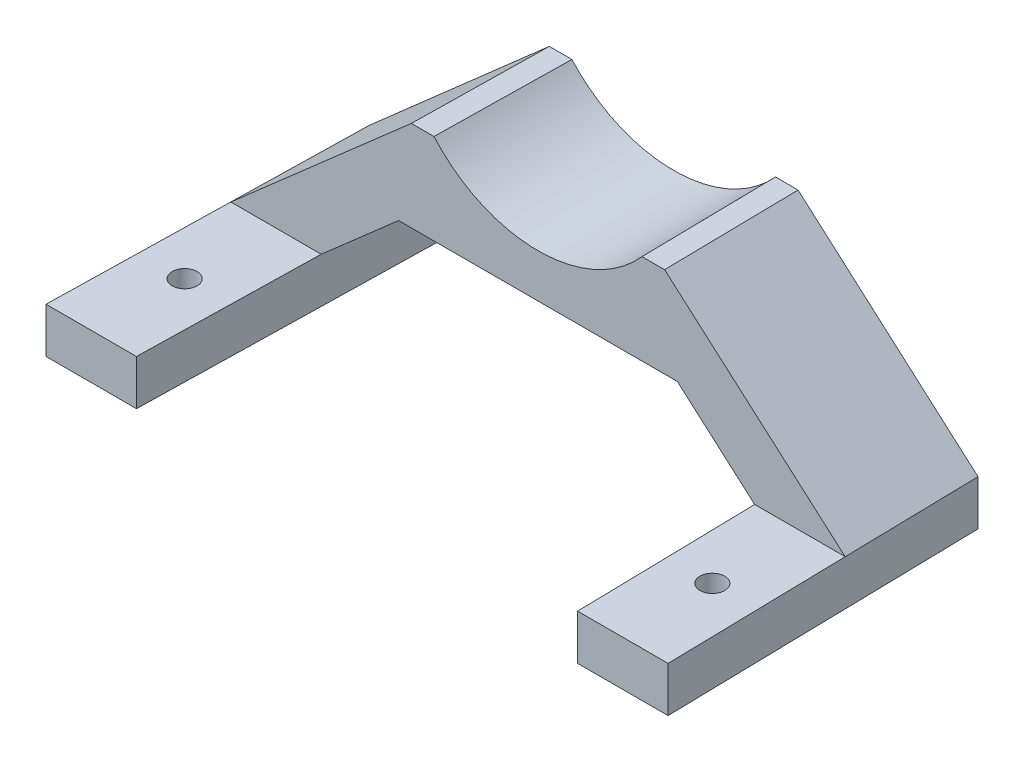
from build123d import *

# Parameters (mm, degrees)
SKETCH1_R             = 2.75
BOSS_EXTRUDE1_DEPTH   = 10
BOSS_EXTRUDE1_2_DEPTH = 10


with BuildPart() as part:
    # Sketch1 → Boss-Extrude1 (new body)
    with BuildSketch(Plane(origin=(0, 0, 0), x_dir=(1, 0, 0), z_dir=(0, 1, 0))):
        Polygon((0, 0), (20.004497681, 0), (21.489122754, 70), (1.484625073, 70), align=None)
        with Locations((10.430924608, 20.212041611)):
            Circle(SKETCH1_R, mode=Mode.SUBTRACT)
    extrude(amount=BOSS_EXTRUDE1_DEPTH)



with BuildPart() as body_2:
    # Sketch1 → Boss-Extrude1 2 (new body)
    with BuildSketch(Plane(origin=(0, 0, 0), x_dir=(1, 0, 0), z_dir=(0, 1, 0))):
        Polygon((116.0383729, 70), (136.042870581, 70), (137.527495654, 0), (117.522997972, 0), align=None)
        with Locations((127.096571045, 20.212041611)):
            Circle(SKETCH1_R, mode=Mode.SUBTRACT)
    extrude(amount=BOSS_EXTRUDE1_2_DEPTH)


with BuildPart() as part_1:
    add(part.part)

    add(body_2.part)  # Loft1 merges body 2
    # Sketch2 for Loft1 → Loft1 section 0
    with BuildSketch(Plane(origin=(0, 0, -70), x_dir=(-1, 0, 0), z_dir=(0, 0, -1))):
        with BuildLine():
            Line((-91.263747827, 45), (-96.263747827, 45))
            Line((-96.263747827, 45), (-136.042870581, 10))
            Line((-136.042870581, 10), (-116.0383729, 10))
            Line((-116.0383729, 10), (-98.990177434, 25))
            Line((-98.990177434, 25), (-38.53731822, 25))
            Line((-38.53731822, 25), (-21.489122754, 10))
            Line((-21.489122754, 10), (-1.484625073, 10))
            Line((-1.484625073, 10), (-41.263747827, 45))
            Line((-41.263747827, 45), (-46.263747827, 45))
            # circular arc as an exact rational Bezier (weights 1, cos(half-angle), 1)
            Bezier((-46.263747827, 45), (-68.763747827, 20.076923077), (-91.263747827, 45), weights=[1, 0.670103093, 1])
        make_face()
    # Sketch3 for Loft1 → Loft1 section 1
    with BuildSketch(Plane(origin=(0, 0, -40), x_dir=(-1, 0, 0), z_dir=(0, 0, -1))):
        with BuildLine():
            Line((-136.679138469, 10), (-96.763747827, 45))
            Line((-96.763747827, 45), (-91.763747827, 45))
            Bezier((-91.763747827, 45), (-68.763747827, 18.956923077), (-45.763747827, 45), weights=[1, 0.661958394, 1])
            Line((-45.763747827, 45), (-40.763747827, 45))
            Line((-40.763747827, 45), (-0.848357184, 10))
            Line((-0.848357184, 10), (-20.852854866, 10))
            Line((-20.852854866, 10), (-37.959450855, 25))
            Line((-37.959450855, 25), (-99.568044798, 25))
            Line((-99.568044798, 25), (-116.674640788, 10))
            Line((-116.674640788, 10), (-136.679138469, 10))
        make_face()
    loft()


solid = part_1.part
